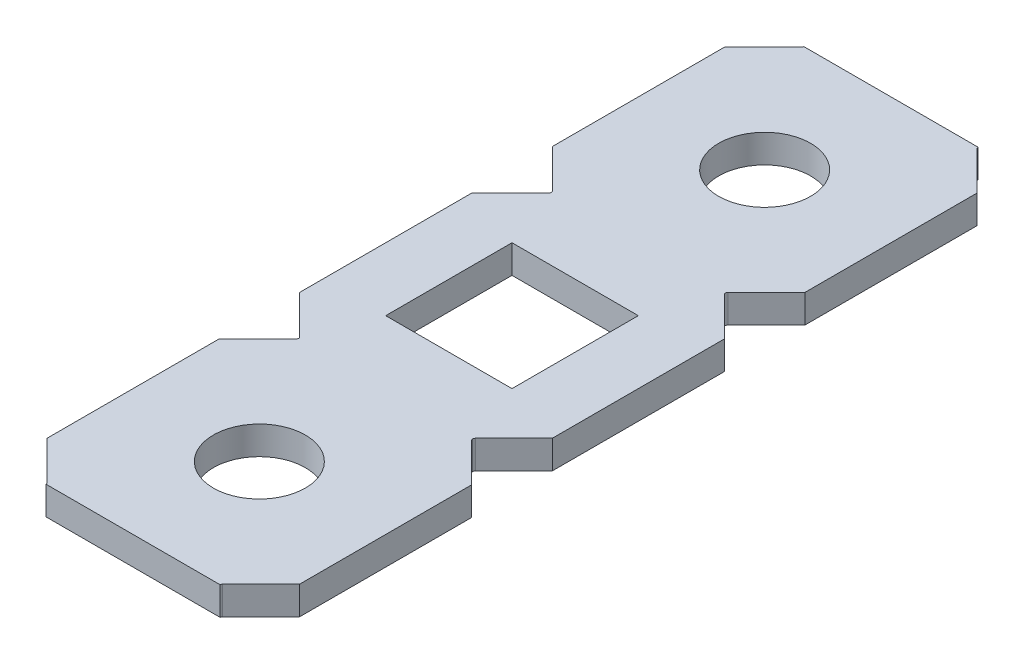
from build123d import *

# Parameters (mm, degrees)
STOCK_HS_LOCK_BAR_3_LONG_1_OUTLINE_W = 6.35
STOCK_HS_LOCK_BAR_3_LONG_1_OUTLINE_H = 6.35
STOCK_HS_LOCK_BAR_3_LONG_1_DEPTH     = 1.4224
BOSS_EXTRUDE1_START                  = -1.4224
BOSS_EXTRUDE1_DEPTH                  = 1.4224


# Read off the part's stored shape, not the designer's step: Stock-HS lock bar 3 long-1
with BuildPart() as part:
    # Stock-HS lock bar 3 long-1 outline → Stock-HS lock bar 3 long-1 (new body)
    with BuildSketch(Plane(origin=(0, 0, 0), x_dir=(1, 0, 0), z_dir=(0, 1, 0))):
        with BuildLine():
            Line((12.7, 36.073014945), (10.762817506, 38.010197439))
            ThreePointArc((10.762817506, 38.010197439), (10.725620068, 38.1), (10.762817506, 38.189802561))
            Line((10.762817506, 38.189802561), (12.7, 40.126985055))
            Line((12.7, 40.126985055), (12.7, 48.773014945))
            Line((12.7, 48.773014945), (10.762817506, 50.710197439))
            ThreePointArc((10.762817506, 50.710197439), (10.725620068, 50.8), (10.762817506, 50.889802561))
            Line((10.762817506, 50.889802561), (12.7, 52.826985055))
            Line((12.7, 52.826985055), (12.7, 61.473014945))
            Line((12.7, 61.473014945), (10.762817506, 63.410197439))
            ThreePointArc((10.762817506, 63.410197439), (10.735287367, 63.451399204), (10.725620068, 63.5))
            Line((10.725620068, 63.5), (1.974379932, 63.5))
            ThreePointArc((1.974379932, 63.5), (1.964712633, 63.451399204), (1.937182494, 63.410197439))
            Line((1.937182494, 63.410197439), (0, 61.473014945))
            Line((0, 61.473014945), (0, 52.826985055))
            Line((0, 52.826985055), (1.937182494, 50.889802561))
            ThreePointArc((1.937182494, 50.889802561), (1.974379932, 50.8), (1.937182494, 50.710197439))
            Line((1.937182494, 50.710197439), (0, 48.773014945))
            Line((0, 48.773014945), (0, 40.126985055))
            Line((0, 40.126985055), (1.937182494, 38.189802561))
            ThreePointArc((1.937182494, 38.189802561), (1.974379932, 38.1), (1.937182494, 38.010197439))
            Line((1.937182494, 38.010197439), (0, 36.073014945))
            Line((0, 36.073014945), (0, 27.426985055))
            Line((0, 27.426985055), (1.937182494, 25.489802561))
            ThreePointArc((1.937182494, 25.489802561), (1.964712633, 25.448600796), (1.974379932, 25.4))
            Line((1.974379932, 25.4), (10.725620068, 25.4))
            ThreePointArc((10.725620068, 25.4), (10.735287367, 25.448600796), (10.762817506, 25.489802561))
            Line((10.762817506, 25.489802561), (12.7, 27.426985055))
            Line((12.7, 27.426985055), (12.7, 36.073014945))
        make_face()
        with BuildLine():
            Line((4.0386, 29.9466), (4.0386, 33.5534))
            ThreePointArc((4.0386, 33.5534), (4.187389755, 33.912610245), (4.5466, 34.0614))
            Line((4.5466, 34.0614), (8.1534, 34.0614))
            ThreePointArc((8.1534, 34.0614), (8.512610245, 33.912610245), (8.6614, 33.5534))
            Line((8.6614, 33.5534), (8.6614, 29.9466))
            ThreePointArc((8.6614, 29.9466), (8.512610245, 29.587389755), (8.1534, 29.4386))
            Line((8.1534, 29.4386), (4.5466, 29.4386))
            ThreePointArc((4.5466, 29.4386), (4.187389755, 29.587389755), (4.0386, 29.9466))
        make_face(mode=Mode.SUBTRACT)
        with Locations((6.35, 44.45)):
            Rectangle(STOCK_HS_LOCK_BAR_3_LONG_1_OUTLINE_W, STOCK_HS_LOCK_BAR_3_LONG_1_OUTLINE_H, mode=Mode.SUBTRACT)
        with BuildLine():
            Line((4.0386, 55.3466), (4.0386, 58.9534))
            ThreePointArc((4.0386, 58.9534), (4.187389755, 59.312610245), (4.5466, 59.4614))
            Line((4.5466, 59.4614), (8.1534, 59.4614))
            ThreePointArc((8.1534, 59.4614), (8.512610245, 59.312610245), (8.6614, 58.9534))
            Line((8.6614, 58.9534), (8.6614, 55.3466))
            ThreePointArc((8.6614, 55.3466), (8.512610245, 54.987389755), (8.1534, 54.8386))
            Line((8.1534, 54.8386), (4.5466, 54.8386))
            ThreePointArc((4.5466, 54.8386), (4.187389755, 54.987389755), (4.0386, 55.3466))
        make_face(mode=Mode.SUBTRACT)
    extrude(amount=STOCK_HS_LOCK_BAR_3_LONG_1_DEPTH)

    # Sketch1 → Boss-Extrude1 (add)
    with BuildSketch(Plane(origin=(0, 1.4224, 0), x_dir=(1, 0, 0), z_dir=(0, 1, 0)).offset(BOSS_EXTRUDE1_START)):
        with BuildLine():
            Line((4.0386, 33.5534), (4.0386, 31.75))
            ThreePointArc((4.0386, 31.75), (4.715593386, 33.384406614), (6.35, 34.0614))
            Line((6.35, 34.0614), (4.5466, 34.0614))
            ThreePointArc((4.5466, 34.0614), (4.187389755, 33.912610245), (4.0386, 33.5534))
        make_face()
        with BuildLine():
            Line((8.1534, 34.0614), (6.35, 34.0614))
            ThreePointArc((6.35, 34.0614), (7.984406614, 33.384406614), (8.6614, 31.75))
            Line((8.6614, 31.75), (8.6614, 33.5534))
            ThreePointArc((8.6614, 33.5534), (8.512610245, 33.912610245), (8.1534, 34.0614))
        make_face()
        with BuildLine():
            ThreePointArc((8.6614, 31.75), (7.984406614, 30.115593386), (6.35, 29.4386))
            Line((6.35, 29.4386), (8.1534, 29.4386))
            ThreePointArc((8.1534, 29.4386), (8.512610245, 29.587389755), (8.6614, 29.9466))
            Line((8.6614, 29.9466), (8.6614, 31.75))
        make_face()
        with BuildLine():
            Line((4.0386, 31.75), (4.0386, 29.9466))
            ThreePointArc((4.0386, 29.9466), (4.187389755, 29.587389755), (4.5466, 29.4386))
            Line((4.5466, 29.4386), (6.35, 29.4386))
            ThreePointArc((6.35, 29.4386), (4.715593386, 30.115593386), (4.0386, 31.75))
        make_face()
        with BuildLine():
            ThreePointArc((8.6614, 57.15), (7.984406614, 55.515593386), (6.35, 54.8386))
            Line((6.35, 54.8386), (8.1534, 54.8386))
            ThreePointArc((8.1534, 54.8386), (8.512610245, 54.987389755), (8.6614, 55.3466))
            Line((8.6614, 55.3466), (8.6614, 57.15))
        make_face()
        with BuildLine():
            ThreePointArc((4.0386, 55.3466), (4.187389755, 54.987389755), (4.5466, 54.8386))
            Line((4.5466, 54.8386), (6.35, 54.8386))
            ThreePointArc((6.35, 54.8386), (4.715593386, 55.515593386), (4.0386, 57.15))
            Line((4.0386, 57.15), (4.0386, 55.3466))
        make_face()
        with BuildLine():
            ThreePointArc((6.350000002, 59.4614), (7.984406615, 58.784406613), (8.6614, 57.15))
            Line((8.6614, 57.15), (8.6614, 58.9534))
            ThreePointArc((8.6614, 58.9534), (8.512610245, 59.312610245), (8.1534, 59.4614))
            Line((8.1534, 59.4614), (6.350000002, 59.4614))
        make_face()
        with BuildLine():
            Line((4.0386, 58.9534), (4.0386, 57.15))
            ThreePointArc((4.0386, 57.15), (4.715593387, 58.784406615), (6.350000002, 59.4614))
            Line((6.350000002, 59.4614), (4.5466, 59.4614))
            ThreePointArc((4.5466, 59.4614), (4.187389755, 59.312610245), (4.0386, 58.9534))
        make_face()
    extrude(amount=BOSS_EXTRUDE1_DEPTH)


solid = part.part
